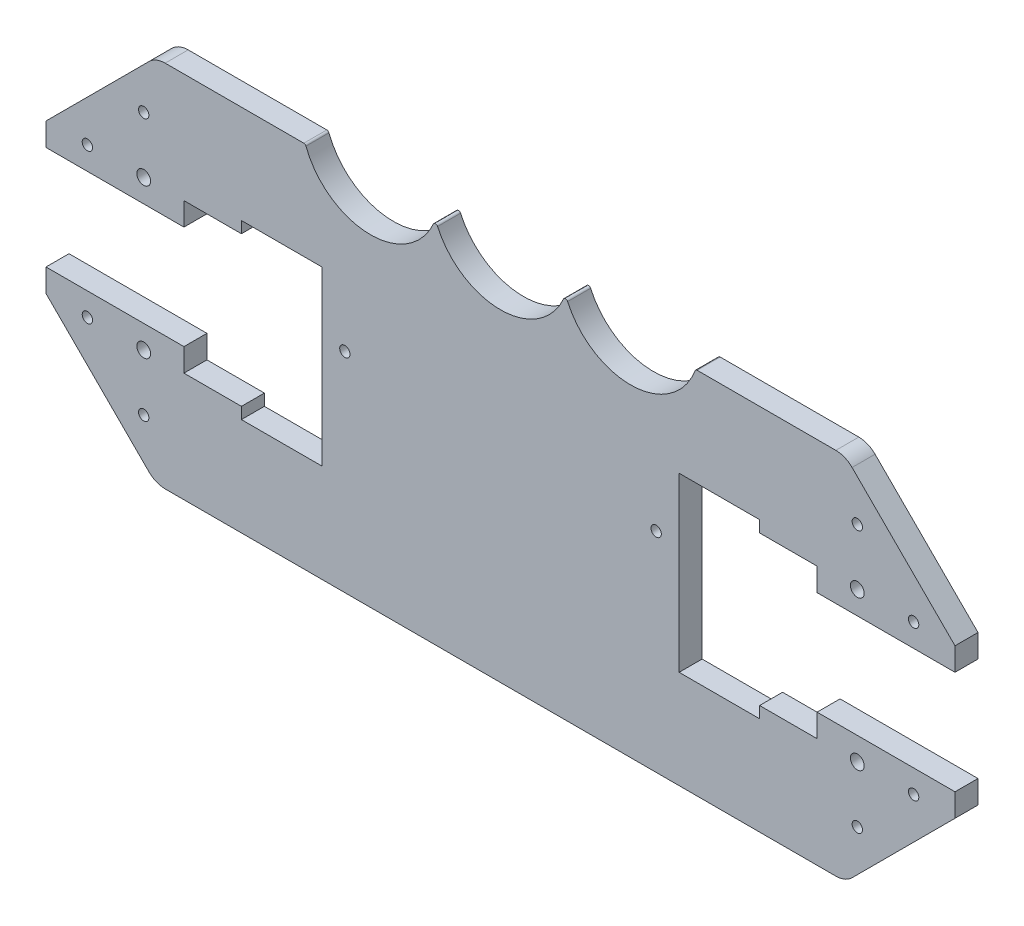
from build123d import *

# Parameters (mm, degrees)
BOSS_EXTRU_1_DEPTH           = 10
ENL_V_MAT_EXTRU_1_DEPTH      = 10
ENL_V_MAT_EXTRU_2_DEPTH      = 214.582138766
ENL_V_MAT_EXTRU_2_DEPTH_BACK = 10
ESQUISSE10_R                 = 2.25
ESQUISSE10_R_2               = 3
ENL_V_MAT_EXTRU_3_DEPTH      = 10
ESQUISSE15_R                 = 2.25
ENL_V_MAT_EXTRU_4_DEPTH      = 10
CONG_1_R                     = 10
CONG_3_R                     = 1


with BuildPart() as part:
    # Esquisse3 → Boss.-Extru.1 (new body)
    with BuildSketch(Plane.XY):
        Polygon((-150, 80.2), (-197.7, 32.5), (-197.7, -32.5), (-150, -80.2), (150, -80.2), (197.7, -32.5), (197.7, 32.5), (150, 80.2), align=None)
    extrude(amount=BOSS_EXTRU_1_DEPTH)

    # Esquisse4 → Enlèv. mat.-Extru.1 (cut)
    with BuildSketch(Plane.XY.offset(10)):
        Polygon((-112.7, 32.5), (-137.7, 32.5), (-137.7, 22.5), (-197.7, 22.5), (-197.7, -22.5), (-137.7, -22.5), (-137.7, -32.5), (-112.7, -32.5), (-112.7, -37.5), (-77.7, -37.5), (-77.7, 37.5), (-112.7, 37.5), align=None)
        Polygon((137.7, 22.5), (137.7, 32.5), (112.7, 32.5), (112.7, 37.5), (77.7, 37.5), (77.7, -37.5), (112.7, -37.5), (112.7, -32.5), (137.7, -32.5), (137.7, -22.5), (197.7, -22.5), (197.7, 22.5), align=None)
    extrude(amount=-ENL_V_MAT_EXTRU_1_DEPTH, mode=Mode.SUBTRACT)

    # Esquisse5 → Enlèv. mat.-Extru.2 (cut, two sides: drawn at the far end of the back side and taken through both)
    with BuildSketch(Plane.XY.offset(10).offset(-ENL_V_MAT_EXTRU_2_DEPTH_BACK)):
        with BuildLine():
            Line((304.790499708, 702.27771674), (84.852813742, 80.2))
            ThreePointArc((84.852813742, 80.2), (56.568542495, 60.2), (28.284271247, 80.2))
            ThreePointArc((28.284271247, 80.2), (0, 60.2), (-28.284271247, 80.2))
            ThreePointArc((-28.284271247, 80.2), (-56.568542495, 60.2), (-84.852813742, 80.2))
            Line((-84.852813742, 80.2), (-304.790499708, 702.27771674))
            Line((-304.790499708, 702.27771674), (-304.790499708, 2021.903832537))
            Line((-304.790499708, 2021.903832537), (304.790499708, 2021.903832537))
            Line((304.790499708, 2021.903832537), (304.790499708, 702.27771674))
        make_face()
    extrude(amount=ENL_V_MAT_EXTRU_2_DEPTH + ENL_V_MAT_EXTRU_2_DEPTH_BACK, mode=Mode.SUBTRACT)

    # Esquisse10 → Enlèv. mat.-Extru.3 (cut)
    with BuildSketch(Plane.XY.offset(10)):
        with Locations((-155.2, 57)):
            Circle(ESQUISSE10_R)
        with Locations((-179.7, 32.5)):
            Circle(ESQUISSE10_R)
        with Locations((-155.2, 32.5)):
            Circle(ESQUISSE10_R_2)
        with Locations((-155.2, -32.5)):
            Circle(ESQUISSE10_R_2)
        with Locations((-179.7, -32.5)):
            Circle(ESQUISSE10_R)
        with Locations((-155.2, -57)):
            Circle(ESQUISSE10_R)
        with Locations((155.2, 32.5)):
            Circle(ESQUISSE10_R_2)
        with Locations((155.2, 57)):
            Circle(ESQUISSE10_R)
        with Locations((179.7, 32.5)):
            Circle(ESQUISSE10_R)
        with Locations((155.2, -32.5)):
            Circle(ESQUISSE10_R_2)
        with Locations((179.7, -32.5)):
            Circle(ESQUISSE10_R)
        with Locations((155.2, -57)):
            Circle(ESQUISSE10_R)
    extrude(amount=-ENL_V_MAT_EXTRU_3_DEPTH, mode=Mode.SUBTRACT)

    # Esquisse15 → Enlèv. mat.-Extru.4 (cut)
    with BuildSketch(Plane.XY.offset(10)):
        with Locations((-67.7, 10.7)):
            Circle(ESQUISSE15_R)
        with Locations((67.7, 10.7)):
            Circle(ESQUISSE15_R)
    extrude(amount=-ENL_V_MAT_EXTRU_4_DEPTH, mode=Mode.SUBTRACT)

    # Congé1
    cong_1_edges = [part.edges().sort_by_distance(p)[0] for p in [
        (150, 80.2, 5),
        (150, -80.2, 5),
        (-150, 80.2, 5),
        (-150, -80.2, 5),
    ]]
    fillet(cong_1_edges, radius=CONG_1_R)

    # Congé3
    cong_3_edges = [part.edges().sort_by_distance(p)[0] for p in [
        (-84.852813742, 80.2, 5),
        (-28.284271247, 80.2, 5),
        (28.284271247, 80.2, 5),
        (84.852813742, 80.2, 5),
    ]]
    fillet(cong_3_edges, radius=CONG_3_R)


solid = part.part
